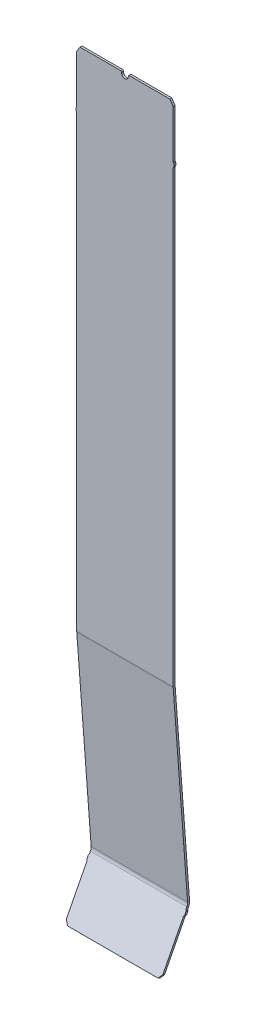
from build123d import *

# Parameters (mm, degrees)
EXTRUDE1_DEPTH         = 6
EXTRUDE2_DEPTH         = 6
PROCESS_BENDS1_START   = 42.277322868
PROCESS_BENDS1_DEPTH   = 6
PROCESS_BENDS1_START_2 = -147.75
PROCESS_BENDS1_2_DEPTH = 295.5
PROCESS_BENDS1_START_3 = -135.25
PROCESS_BENDS1_3_DEPTH = 270.5
PROCESS_BENDS1_START_4 = -145.75
PROCESS_BENDS1_4_DEPTH = 291.5
PROCESS_BENDS1_5_DEPTH = 6


with BuildPart() as part:
    # Sketch1 → Extrude1 (new body)
    with BuildSketch(Plane.XY):
        with BuildLine():
            Line((-135.25, 0), (135.25, 0))
            ThreePointArc((135.25, 0), (136.591640787, 0.316718427), (137.65, 1.2))
            Line((137.65, 1.2), (145.15, 11.2))
            ThreePointArc((145.15, 11.2), (145.596049894, 12.051316702), (145.75, 13))
            Line((145.75, 13), (145.75, 2290))
            Line((145.75, 2290), (135.75, 2305))
            Line((135.75, 2305), (13, 2305))
            ThreePointArc((13, 2305), (10.878679656, 2304.121320344), (10, 2302))
            Line((10, 2302), (10, 2300))
            ThreePointArc((10, 2300), (0, 2290), (-10, 2300))
            Line((-10, 2300), (-10, 2302))
            ThreePointArc((-10, 2302), (-10.878679656, 2304.121320344), (-13, 2305))
            Line((-13, 2305), (-135.75, 2305))
            Line((-135.75, 2305), (-145.75, 2290))
            Line((-145.75, 2290), (-145.75, 13))
            ThreePointArc((-145.75, 13), (-145.596049894, 12.051316702), (-145.15, 11.2))
            Line((-145.15, 11.2), (-137.65, 1.2))
            ThreePointArc((-137.65, 1.2), (-136.591640787, 0.316718427), (-135.25, 0))
        make_face()
    extrude(amount=EXTRUDE1_DEPTH)

    # Sketch3 → Extrude2 (add)
    with BuildSketch(Plane.XY.offset(6)):
        with BuildLine():
            Line((147.348076211, 2142.232050808), (146.151923789, 2144.303847577))
            ThreePointArc((146.151923789, 2144.303847577), (145.852222521, 2145.027390442), (145.75, 2145.803847577))
            Line((145.75, 2145.803847577), (145.75, 2129.196152423))
            ThreePointArc((145.75, 2129.196152423), (145.852222521, 2129.972609558), (146.151923789, 2130.696152423))
            Line((146.151923789, 2130.696152423), (147.348076211, 2132.767949192))
            ThreePointArc((147.348076211, 2132.767949192), (147.647777479, 2133.491492057), (147.75, 2134.267949192))
            Line((147.75, 2134.267949192), (147.75, 2140.732050808))
            ThreePointArc((147.75, 2140.732050808), (147.647777479, 2141.508507943), (147.348076211, 2142.232050808))
        make_face()
        with BuildLine():
            Line((-145.75, 2129.196152423), (-145.75, 2145.803847577))
            ThreePointArc((-145.75, 2145.803847577), (-145.852222521, 2145.027390442), (-146.151923789, 2144.303847577))
            Line((-146.151923789, 2144.303847577), (-147.348076211, 2142.232050808))
            ThreePointArc((-147.348076211, 2142.232050808), (-147.647777479, 2141.508507943), (-147.75, 2140.732050808))
            Line((-147.75, 2140.732050808), (-147.75, 2134.267949192))
            ThreePointArc((-147.75, 2134.267949192), (-147.647777479, 2133.491492057), (-147.348076211, 2132.767949192))
            Line((-147.348076211, 2132.767949192), (-146.151923789, 2130.696152423))
            ThreePointArc((-146.151923789, 2130.696152423), (-145.852222521, 2129.972609558), (-145.75, 2129.196152423))
        make_face()
        with BuildLine():
            Line((145.75, 149.196152423), (145.75, 165.803847577))
            ThreePointArc((145.75, 165.803847577), (145.852222521, 165.027390442), (146.151923789, 164.303847577))
            Line((146.151923789, 164.303847577), (147.348076211, 162.232050808))
            ThreePointArc((147.348076211, 162.232050808), (147.647777479, 161.508507943), (147.75, 160.732050808))
            Line((147.75, 160.732050808), (147.75, 154.267949192))
            ThreePointArc((147.75, 154.267949192), (147.647777479, 153.491492057), (147.348076211, 152.767949192))
            Line((147.348076211, 152.767949192), (146.151923789, 150.696152423))
            ThreePointArc((146.151923789, 150.696152423), (145.852222521, 149.972609558), (145.75, 149.196152423))
        make_face()
        with BuildLine():
            Line((-147.348076211, 162.232050808), (-146.151923789, 164.303847577))
            ThreePointArc((-146.151923789, 164.303847577), (-145.852222521, 165.027390442), (-145.75, 165.803847577))
            Line((-145.75, 165.803847577), (-145.75, 149.196152423))
            ThreePointArc((-145.75, 149.196152423), (-145.852222521, 149.972609558), (-146.151923789, 150.696152423))
            Line((-146.151923789, 150.696152423), (-147.348076211, 152.767949192))
            ThreePointArc((-147.348076211, 152.767949192), (-147.647777479, 153.491492057), (-147.75, 154.267949192))
            Line((-147.75, 154.267949192), (-147.75, 160.732050808))
            ThreePointArc((-147.75, 160.732050808), (-147.647777479, 161.508507943), (-147.348076211, 162.232050808))
        make_face()
    extrude(amount=-EXTRUDE2_DEPTH)

    # Process-Bends1 2 outline → Process-Bends1 2 (cut)
    with BuildSketch(Plane.YZ.offset(PROCESS_BENDS1_START_2)):
        Polygon((92.396611983, 0), (80.736895303, 6), (0, 6), (0, 0), align=None)
        with BuildLine():
            Line((770.847206555, 6), (93.849827585, 6))
            Line((93.849827585, 6), (105.509544266, 0))
            Line((105.509544266, 0), (689.517739901, 0))
            Line((689.517739901, 0), (768.911335172, 5.927830646))
            ThreePointArc((768.911335172, 5.927830646), (769.878598478, 5.981951397), (770.847206555, 6))
        make_face()
    extrude(amount=PROCESS_BENDS1_2_DEPTH, mode=Mode.SUBTRACT)

    # Process-Bends1 3 outline → Process-Bends1 3 (add)
    with BuildSketch(Plane.YZ.offset(PROCESS_BENDS1_START_3)):
        Polygon((22.221302391, 42.859484921), (19.475921021, 37.524423428), (80.736895303, 6), (93.849827585, 6), align=None)
        with BuildLine():
            Line((105.509544266, 0), (92.396611983, 0))
            Line((92.396611983, 0), (171.747570561, -40.833389396))
            ThreePointArc((171.747570561, -40.833389396), (178.469550701, -43.194639768), (185.580094549, -43.64262024))
            Line((185.580094549, -43.64262024), (769.358074722, -0.055514888))
            ThreePointArc((769.358074722, -0.055514888), (770.102123419, -0.013883541), (770.847206555, 0))
            Line((770.847206555, 0), (689.517739901, 0))
            Line((689.517739901, 0), (185.133354999, -37.659274706))
            ThreePointArc((185.133354999, -37.659274706), (179.663705885, -37.314674343), (174.492951931, -35.498327904))
            Line((174.492951931, -35.498327904), (105.509544266, 0))
        make_face()
    extrude(amount=PROCESS_BENDS1_3_DEPTH)



with BuildPart() as body_2:
    # Process-Bends1: read off the stored shape, not the designer's step
    # Process-Bends1 outline → Process-Bends1 (new body)
    with BuildSketch(Plane(origin=(0, 0, 0), x_dir=(1, 0, 0), z_dir=(0, 0.457563561703474, 0.889176915468025)).offset(PROCESS_BENDS1_START)):
        with BuildLine():
            ThreePointArc((-145.75, 165.951578122), (-145.852222521, 165.175120987), (-146.151923789, 164.451578122))
            Line((-146.151923789, 164.451578122), (-147.348076211, 162.379781352))
            ThreePointArc((-147.348076211, 162.379781352), (-147.647777479, 161.656238487), (-147.75, 160.879781352))
            Line((-147.75, 160.879781352), (-147.75, 154.415679737))
            ThreePointArc((-147.75, 154.415679737), (-147.647777479, 153.639222602), (-147.348076211, 152.915679737))
            Line((-147.348076211, 152.915679737), (-146.151923789, 150.843882967))
            ThreePointArc((-146.151923789, 150.843882967), (-145.852222521, 150.120340102), (-145.75, 149.343882967))
            Line((-145.75, 149.343882967), (-145.75, 165.951578122))
        make_face()
        with BuildLine():
            Line((145.75, 165.951578122), (145.75, 149.343882967))
            ThreePointArc((145.75, 149.343882967), (145.852222521, 150.120340102), (146.151923789, 150.843882967))
            Line((146.151923789, 150.843882967), (147.348076211, 152.915679737))
            ThreePointArc((147.348076211, 152.915679737), (147.647777479, 153.639222602), (147.75, 154.415679737))
            Line((147.75, 154.415679737), (147.75, 160.879781352))
            ThreePointArc((147.75, 160.879781352), (147.647777479, 161.656238487), (147.348076211, 162.379781352))
            Line((147.348076211, 162.379781352), (146.151923789, 164.451578122))
            ThreePointArc((146.151923789, 164.451578122), (145.852222521, 165.175120987), (145.75, 165.951578122))
        make_face()
    extrude(amount=PROCESS_BENDS1_DEPTH)


with BuildPart() as part_1:
    add(part.part)

    add(body_2.part)  # Process-Bends1 4 merges body 2
    # Process-Bends1 4 outline → Process-Bends1 4 (add)
    with BuildSketch(Plane.YZ.offset(PROCESS_BENDS1_START_4)):
        with BuildLine():
            Line((105.509544266, 0), (92.396611983, 0))
            Line((92.396611983, 0), (171.747570561, -40.833389396))
            ThreePointArc((171.747570561, -40.833389396), (178.469550701, -43.194639768), (185.580094549, -43.64262024))
            Line((185.580094549, -43.64262024), (769.358074722, -0.055514888))
            ThreePointArc((769.358074722, -0.055514888), (770.102123419, -0.013883541), (770.847206555, 0))
            Line((770.847206555, 0), (689.517739901, 0))
            Line((689.517739901, 0), (185.133354999, -37.659274706))
            ThreePointArc((185.133354999, -37.659274706), (179.663705885, -37.314674343), (174.492951931, -35.498327904))
            Line((174.492951931, -35.498327904), (105.509544266, 0))
        make_face()
    extrude(amount=PROCESS_BENDS1_4_DEPTH)

    # Process-Bends1 5 outline → Process-Bends1 5 (add)
    with BuildSketch(Plane(origin=(0, 0, 0), x_dir=(1, 0, 0), z_dir=(0, 0.457563561703474, 0.889176915468025)).offset(PROCESS_BENDS1_START)):
        with BuildLine():
            Line((-145.75, 82), (-145.75, 13.147730544))
            ThreePointArc((-145.75, 13.147730544), (-145.596049894, 12.199047246), (-145.15, 11.347730544))
            Line((-145.15, 11.347730544), (-137.65, 1.347730544))
            ThreePointArc((-137.65, 1.347730544), (-136.591640786, 0.464448971), (-135.25, 0.147730544))
            Line((-135.25, 0.147730544), (-135.25, 82))
            Line((-135.25, 82), (-145.75, 82))
        make_face()
        with BuildLine():
            Line((145.75, 82), (135.25, 82))
            Line((135.25, 82), (135.25, 0.147730544))
            ThreePointArc((135.25, 0.147730544), (136.591640786, 0.464448971), (137.65, 1.347730544))
            Line((137.65, 1.347730544), (145.15, 11.347730544))
            ThreePointArc((145.15, 11.347730544), (145.596049894, 12.199047246), (145.75, 13.147730544))
            Line((145.75, 13.147730544), (145.75, 82))
        make_face()
    extrude(amount=PROCESS_BENDS1_5_DEPTH)


solid = part_1.part
